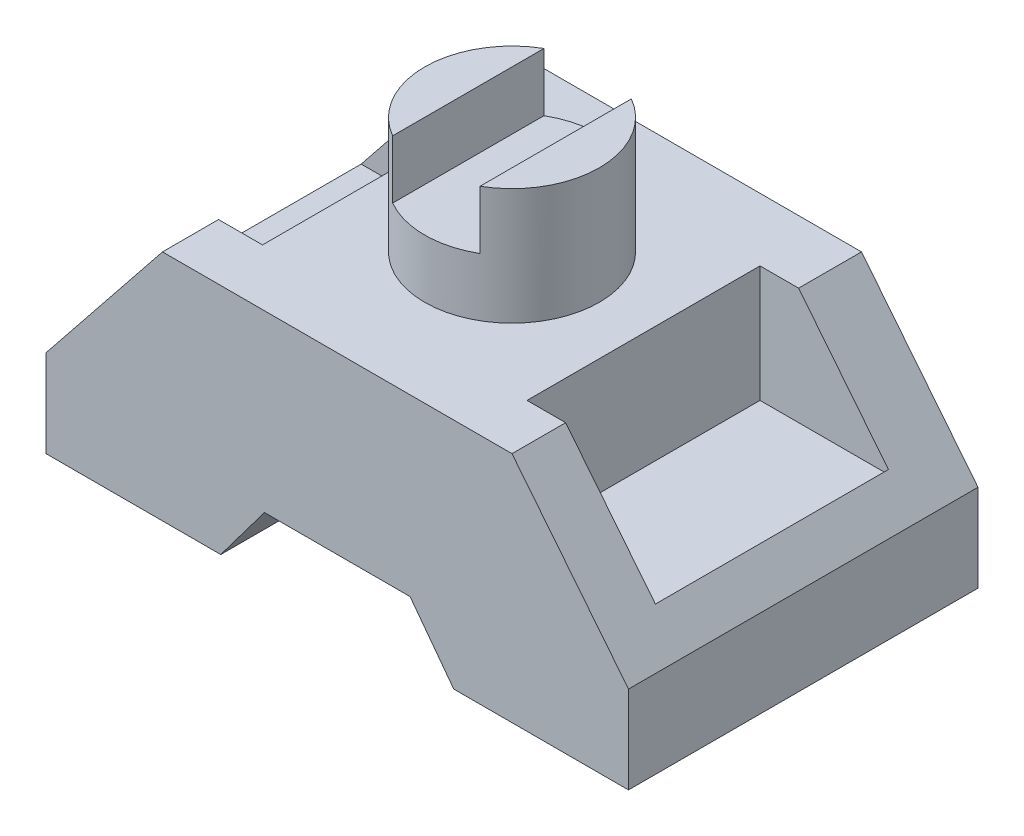
from build123d import *

# Parameters (mm, degrees)
RESSALTO_EXTRUS_O2_DEPTH = 60
ESBO_O2_R                = 15
RESSALTO_EXTRUS_O4_DEPTH = 20
ESBO_O6_W                = 15
ESBO_O6_H                = 48.5864471
CORTE_EXTRUS_O11_DEPTH   = 10
ESBO_O8_W                = 37.926129593
ESBO_O8_H                = 40.488705916
CORTE_EXTRUS_O13_DEPTH   = 20
ESBO_O9_W                = 22.038156385
ESBO_O9_H                = 40
CORTE_EXTRUS_O14_DEPTH   = 20


with BuildPart() as part:
    # Esboço1 → Ressalto-extrusão2 (new body)
    with BuildSketch(Plane.XY):
        Polygon((0, 0), (0, 15), (20, 40), (80, 40), (100, 15), (100, 0), (70, 0), (62.5, 10), (37.5, 10), (30, 0), align=None)
    extrude(amount=RESSALTO_EXTRUS_O2_DEPTH)

    # Esboço2 → Ressalto-extrusão4 (add)
    with BuildSketch(Plane(origin=(0, 40, 0), x_dir=(1, 0, 0), z_dir=(0, 1, 0))):
        with Locations((50, -30)):
            Circle(ESBO_O2_R)
    extrude(amount=RESSALTO_EXTRUS_O4_DEPTH)

    # Esboço6 → Corte-extrusão11 (cut)
    with BuildSketch(Plane(origin=(0, 60, 0), x_dir=(1, 0, 0), z_dir=(0, 1, 0))):
        with Locations((50, -30)):
            Rectangle(ESBO_O6_W, ESBO_O6_H)
    extrude(amount=-CORTE_EXTRUS_O11_DEPTH, mode=Mode.SUBTRACT)

    # Esboço8 → Corte-extrusão13 (cut)
    with BuildSketch(Plane(origin=(0, 40, 0), x_dir=(1, 0, 0), z_dir=(0, 1, 0))):
        with Locations((8.588766608, -30.137353967)):
            Rectangle(ESBO_O8_W, ESBO_O8_H)
    extrude(amount=-CORTE_EXTRUS_O13_DEPTH, mode=Mode.SUBTRACT)

    # Esboço9 → Corte-extrusão14 (cut)
    with BuildSketch(Plane(origin=(0, 40, 0), x_dir=(1, 0, 0), z_dir=(0, 1, 0))):
        with Locations((84.389774266, -30.791719137)):
            Rectangle(ESBO_O9_W, ESBO_O9_H)
    extrude(amount=-CORTE_EXTRUS_O14_DEPTH, mode=Mode.SUBTRACT)


solid = part.part
